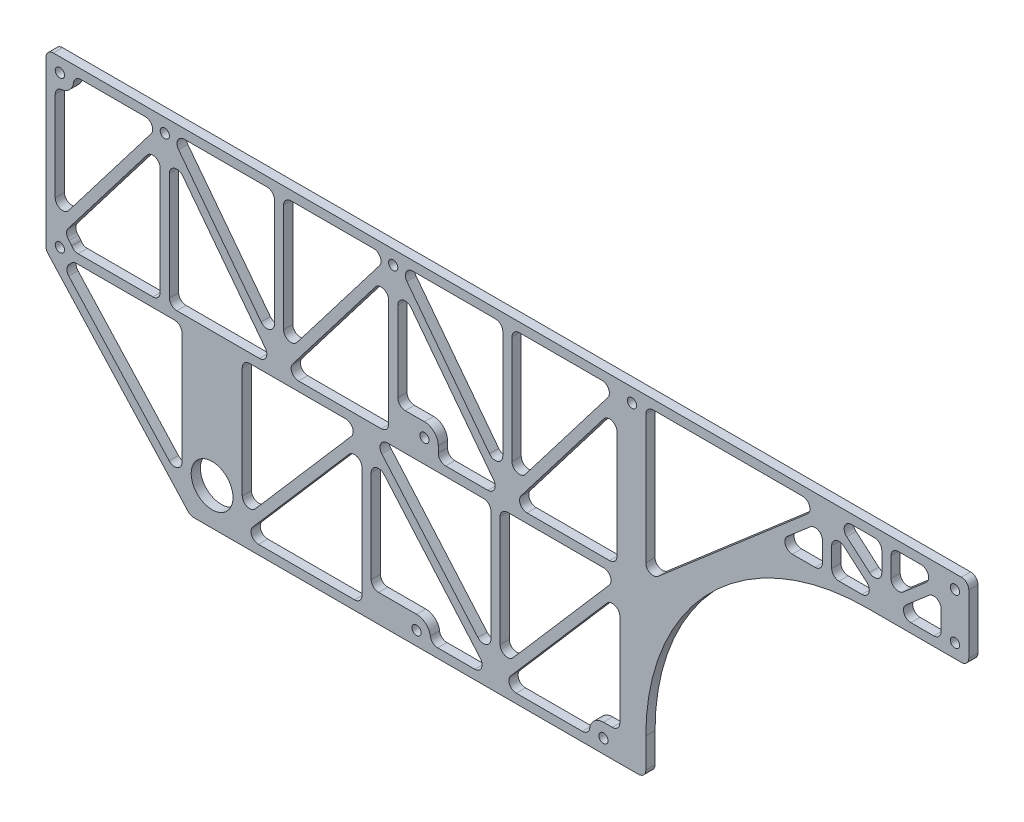
from build123d import *

# Parameters (mm, degrees)
SKETCH1_W           = 635
SKETCH1_H           = 228.6
SKETCH1_R           = 14.3891
BOSS_EXTRUDE1_DEPTH = 6.35
SKETCH2_R           = 3.175
CUT_EXTRUDE1_DEPTH  = 338.507129554
LPATTERN2_DEPTH     = 6.35
SKETCH3_R           = 3.175
BOSS_EXTRUDE2_DEPTH = 6.35
SKETCH4_R           = 3.175
BOSS_EXTRUDE5_DEPTH = 6.35
CUT_EXTRUDE2_DEPTH  = 338.507129566
SKETCH6_R           = 9.525
SKETCH6_R_2         = 3.175
BOSS_EXTRUDE6_DEPTH = 6.35
SKETCH6_4_R         = 3.175
CUT_EXTRUDE4_DEPTH  = 338.507129554
FILLET1_R           = 5.08
SKETCH7_W           = 222.25
SKETCH7_H           = 287.708406978
CUT_EXTRUDE5_DEPTH  = 338.507129554
SKETCH8_W           = 13.49375
SKETCH8_H           = 228.6
BOSS_EXTRUDE7_DEPTH = 6.35
SKETCH9_R           = 3.175
CUT_EXTRUDE6_DEPTH  = 338.507129554
FILLET2_R           = 5.08
SKETCH12_R          = 3.175
BOSS_EXTRUDE8_DEPTH = 6.35
SKETCH13_W          = 222.25
SKETCH13_H          = 50.8
BOSS_EXTRUDE9_DEPTH = 6.35
SKETCH14_R          = 3.175
CUT_EXTRUDE7_DEPTH  = 338.507129554
FILLET3_R           = 5.08


with BuildPart() as part:
    # Sketch1 → Boss-Extrude1 (new body)
    with BuildSketch(Plane.XY):
        Rectangle(SKETCH1_W, SKETCH1_H)
        with Locations((206.82458, -88.9)):
            Circle(SKETCH1_R, mode=Mode.SUBTRACT)
        with Locations((-203.2, -88.9)):
            Circle(SKETCH1_R, mode=Mode.SUBTRACT)
    extrude(amount=BOSS_EXTRUDE1_DEPTH)

    # Sketch2 → Cut-Extrude1 (cut, through all)
    with BuildSketch(Plane.XY.offset(6.35)):
        with Locations((307.975, -104.775)):
            Circle(SKETCH2_R)
        with Locations(Location((-307.975, -104.775, 0), (0, 0, 180))):
            Circle(SKETCH2_R)
        with BuildLine():
            Line((-311.15, -12.584475377), (-311.15, -95.25))
            Line((-311.15, -95.25), (-307.975, -95.25))
            ThreePointArc((-307.975, -95.25), (-301.239807909, -98.039807909), (-298.45, -104.775))
            Line((-298.45, -104.775), (-298.45, -107.95))
            Line((-298.45, -107.95), (-223.9391, -107.95))
            Line((-223.9391, -107.95), (-311.15, -12.584475377))
        make_face()
        Polygon((-311.15, -3.175), (-223.9391, -98.540524623), (-223.9391, -3.175), align=None)
        Polygon((-311.15, 107.95), (-311.15, 13.619737424), (-238.91875, 107.95), align=None)
        with BuildLine():
            Line((311.15, -11.346724197), (311.15, -95.25))
            Line((311.15, -95.25), (307.975, -95.25))
            ThreePointArc((307.975, -95.25), (301.239807909, -98.039807909), (298.45, -104.775))
            Line((298.45, -104.775), (298.45, -107.95))
            Line((298.45, -107.95), (227.56368, -107.95))
            Line((227.56368, -107.95), (311.15, -11.346724197))
        make_face()
        Polygon((311.15, -1.64199312), (227.56368, -1.64199312), (227.56368, -98.245268924), align=None)
        Polygon((-238.91875, 97.505262576), (-311.15, 3.175), (-238.91875, 3.175), align=None)
        Polygon((-160.3375, 3.175), (-232.56875, 3.175), (-232.56875, 97.505262576), align=None)
        Polygon((-160.3375, 13.619737424), (-232.56875, 107.95), (-160.3375, 107.95), align=None)
        Polygon((-100.086795, -3.175), (-182.4609, -98.25253875), (-182.4609, -3.175), align=None)
        Polygon((-182.4609, -107.95), (-100.086795, -107.95), (-100.086795, -12.87246125), align=None)
        Polygon((-11.36269, -107.95), (-93.736795, -107.95), (-93.736795, -12.87246125), align=None)
        Polygon((-93.736795, -3.175), (-11.36269, -98.25253875), (-11.36269, -3.175), align=None)
        Polygon((-5.01269, -3.175), (77.361415, -3.175), (-5.01269, -98.25253875), align=None)
        Polygon((-5.01269, -107.95), (77.361415, -12.87246125), (77.361415, -107.95), align=None)
        Polygon((83.711415, -3.175), (186.08548, -3.175), (186.08548, -99.241977854), align=None)
        Polygon((83.711415, -11.883022146), (83.711415, -107.95), (186.08548, -107.95), align=None)
    extrude(amount=-CUT_EXTRUDE1_DEPTH, mode=Mode.SUBTRACT)

    # LPattern2: read off the stored shape, not the designer's step
    # LPattern2 outline → LPattern2 (cut)
    with BuildSketch(Plane.XY):
        Polygon((238.91875, 3.175), (311.15, 3.175), (238.91875, 97.505262576), align=None)
        Polygon((238.91875, 107.95), (311.15, 13.619737424), (311.15, 107.95), align=None)
        Polygon((160.3375, 13.619737424), (232.56875, 107.95), (160.3375, 107.95), align=None)
        Polygon((153.9875, 13.619737424), (153.9875, 107.95), (81.75625, 107.95), align=None)
        Polygon((3.175, 13.619737424), (75.40625, 107.95), (3.175, 107.95), align=None)
        Polygon((-3.175, 13.619737424), (-3.175, 107.95), (-75.40625, 107.95), align=None)
        Polygon((-153.9875, 13.619737424), (-81.75625, 107.95), (-153.9875, 107.95), align=None)
        Polygon((232.56875, 97.505262576), (160.3375, 3.175), (232.56875, 3.175), align=None)
        Polygon((81.75625, 97.505262576), (81.75625, 3.175), (153.9875, 3.175), align=None)
        Polygon((75.40625, 97.505262576), (3.175, 3.175), (75.40625, 3.175), align=None)
        Polygon((-75.40625, 97.505262576), (-75.40625, 3.175), (-3.175, 3.175), align=None)
        Polygon((-81.75625, 97.505262576), (-153.9875, 3.175), (-81.75625, 3.175), align=None)
    extrude(amount=LPATTERN2_DEPTH, mode=Mode.SUBTRACT)

    # Sketch3 → Boss-Extrude2 (add)
    # profile 1 of 4: a face of its own
    with BuildSketch(Plane.XY.offset(6.35)):
        with BuildLine():
            ThreePointArc((-298.45, 104.775), (-301.239807909, 98.039807909), (-307.975, 95.25))
            Line((-307.975, 95.25), (-311.15, 95.25))
            Line((-311.15, 95.25), (-311.15, 107.95))
            Line((-311.15, 107.95), (-298.45, 107.95))
            Line((-298.45, 107.95), (-298.45, 104.775))
        make_face()
        with Locations((-307.975, 104.775)):
            Circle(SKETCH3_R, mode=Mode.SUBTRACT)
    # profile 2 of 4: a face of its own
    with BuildSketch(Plane.XY.offset(6.35)):
        with BuildLine():
            Line((298.45, 104.775), (298.45, 107.95))
            Line((298.45, 107.95), (311.15, 107.95))
            Line((311.15, 107.95), (311.15, 95.25))
            Line((311.15, 95.25), (307.975, 95.25))
            ThreePointArc((307.975, 95.25), (301.239807909, 98.039807909), (298.45, 104.775))
        make_face()
        with Locations((307.975, 104.775)):
            Circle(SKETCH3_R, mode=Mode.SUBTRACT)
    # profile 3 of 4: a face of its own
    with BuildSketch(Plane.XY.offset(6.35)):
        with BuildLine():
            Line((311.15, 107.95), (307.975, 107.95))
            ThreePointArc((307.975, 107.95), (310.22006403, 107.02006403), (311.15, 104.775))
            Line((311.15, 104.775), (311.15, 107.95))
        make_face()
    # profile 4 of 4: a face of its own
    with BuildSketch(Plane.XY.offset(6.35)):
        with BuildLine():
            Line((-311.15, 107.95), (-311.15, 104.775))
            ThreePointArc((-311.15, 104.775), (-310.22006403, 107.02006403), (-307.975, 107.95))
            Line((-307.975, 107.95), (-311.15, 107.95))
        make_face()
    extrude(amount=-BOSS_EXTRUDE2_DEPTH)

    # Sketch4 → Boss-Extrude5 (add)
    # profile 1 of 2: a face of its own
    with BuildSketch(Plane(origin=(0, 0, 0), x_dir=(-1, 0, 0), z_dir=(0, 0, -1))):
        with BuildLine():
            Line((-56.55818, -104.775), (-56.55818, -114.3))
            Line((-56.55818, -114.3), (-83.711415, -114.3))
            Line((-83.711415, -114.3), (-83.711415, -95.25))
            Line((-83.711415, -95.25), (-66.08318, -95.25))
            ThreePointArc((-66.08318, -95.25), (-59.347987909, -98.039807909), (-56.55818, -104.775))
        make_face()
        with Locations((-66.08318, -104.775)):
            Circle(SKETCH4_R, mode=Mode.SUBTRACT)
    # profile 2 of 2: a face of its own
    with BuildSketch(Plane(origin=(0, 0, 0), x_dir=(-1, 0, 0), z_dir=(0, 0, -1))):
        with BuildLine():
            ThreePointArc((52.9336, -104.775), (55.723407909, -98.039807909), (62.4586, -95.25))
            Line((62.4586, -95.25), (100.086795, -95.25))
            Line((100.086795, -95.25), (100.086795, -114.3))
            Line((100.086795, -114.3), (52.9336, -114.3))
            Line((52.9336, -114.3), (52.9336, -104.775))
        make_face()
        with Locations((62.4586, -104.775)):
            Circle(SKETCH4_R, mode=Mode.SUBTRACT)
    extrude(amount=-BOSS_EXTRUDE5_DEPTH)

    # Sketch5 → Cut-Extrude2 (cut, through all)
    with BuildSketch(Plane(origin=(0, 0, 0), x_dir=(-1, 0, 0), z_dir=(0, 0, -1))):
        Polygon((-328.541000194, 8.752588565), (-195.250866234, -145.294910748), (-328.541000194, -145.294910748), align=None)
        Polygon((209.527146653, -123.709537991), (340.288435142, 19.278538924), (340.288435142, -123.709537991), align=None)
    extrude(amount=-CUT_EXTRUDE2_DEPTH, mode=Mode.SUBTRACT)

    # Sketch6 → Boss-Extrude6 (add)
    # profile 1 of 2: a face of its own
    with BuildSketch(Plane(origin=(0, 0, 0), x_dir=(-1, 0, 0), z_dir=(0, 0, -1))):
        with Locations((-307.975, 0.76650344)):
            Circle(SKETCH6_R)
        with Locations((-307.975, 0.76650344)):
            Circle(SKETCH6_R_2, mode=Mode.SUBTRACT)
    # profile 2 of 2: a face of its own
    with BuildSketch(Plane(origin=(0, 0, 0), x_dir=(-1, 0, 0), z_dir=(0, 0, -1))):
        with Locations((307.975, 0.76650344)):
            Circle(SKETCH6_R)
        with Locations((307.975, 0.76650344)):
            Circle(SKETCH6_R_2, mode=Mode.SUBTRACT)
    extrude(amount=-BOSS_EXTRUDE6_DEPTH)

    # Sketch6<4> → Cut-Extrude4 (cut, through all)
    with BuildSketch(Plane(origin=(0, 0, 0), x_dir=(-1, 0, 0), z_dir=(0, 0, -1))):
        with Locations((307.975, 0.76650344)):
            Circle(SKETCH6_4_R)
        with Locations((-307.975, 0.76650344)):
            Circle(SKETCH6_4_R)
    extrude(amount=-CUT_EXTRUDE4_DEPTH, mode=Mode.SUBTRACT)

    # Fillet1
    # the kernel refuses this fillet: 5.08 mm, written as the material it adds along each edge
    with BuildSketch(Plane(origin=(83.711415, -11.883022146, 6.35), x_dir=(0.7292126608683634, -0.6842871438433438, 0), z_dir=(0, 0, -1))) as fillet1_piece_1:
        with BuildLine():
            CenterArc((FILLET1_R * 2.30973381872, FILLET1_R), FILLET1_R, 136.820429188, 133.179570812)
            Line((FILLET1_R * 1.58052115785, FILLET1_R * 1.68428714384), (0, 0))
            Line((0, 0), (FILLET1_R * 2.30973381872, 0))
        make_face()
    extrude(amount=6.35)
    with BuildSketch(Plane(origin=(186.08548, -107.95, 6.35), x_dir=(-0.7292126608683638, 0.6842871438433435, 0), z_dir=(0, 0, -1)), Plane(origin=(83.711415, -3.175, 6.35), x_dir=(0.7292126608683626, -0.6842871438433448, 0), z_dir=(0, 0, -1))) as fillet1_piece_2:
        with BuildLine():
            CenterArc((FILLET1_R * 2.52702783682, -FILLET1_R), FILLET1_R, 90, 136.820429188)
            Line((FILLET1_R * 1.84274069297, -FILLET1_R * 1.72921266087), (0, 0))
            Line((0, 0), (FILLET1_R * 2.52702783682, 0))
        make_face()
    extrude(amount=6.35)
    with BuildSketch(Plane(origin=(83.711415, -107.95, 6.35), x_dir=(1, 0, 0), z_dir=(0, 0, -1)), Plane(origin=(-182.4609, -3.175, 6.35), x_dir=(0, -1, 0), z_dir=(0, 0, -1)), Plane(origin=(-100.086795, -107.95, 6.35), x_dir=(0, 1, 0), z_dir=(0, 0, -1)), Plane(origin=(227.56368, -1.64199312, 6.35), x_dir=(0, -1, 0), z_dir=(0, 0, -1)), Plane(origin=(-81.75625, 3.175, 0), x_dir=(-1, 0, 0), z_dir=(0, 0, 1)), Plane(origin=(-153.9875, 107.95, 0), x_dir=(1, 0, 0), z_dir=(0, 0, 1)), Plane(origin=(75.40625, 3.175, 0), x_dir=(-1, 0, 0), z_dir=(0, 0, 1)), Plane(origin=(3.175, 107.95, 0), x_dir=(1, 0, 0), z_dir=(0, 0, 1)), Plane(origin=(232.56875, 3.175, 0), x_dir=(-1, 0, 0), z_dir=(0, 0, 1)), Plane(origin=(160.3375, 107.95, 0), x_dir=(1, 0, 0), z_dir=(0, 0, 1)), Plane(origin=(238.91875, 3.175, 0), x_dir=(0, 1, 0), z_dir=(0, 0, 1)), Plane(origin=(-93.736795, -95.25, 6.35), x_dir=(1, 0, 0), z_dir=(0, 0, -1)), Plane(origin=(-160.3375, 107.95, 6.35), x_dir=(-1, 0, 0), z_dir=(0, 0, -1)), Plane(origin=(-5.01269, -3.175, 6.35), x_dir=(0, -1, 0), z_dir=(0, 0, -1)), Plane(origin=(-238.91875, 3.175, 6.35), x_dir=(0, 1, 0), z_dir=(0, 0, -1))) as fillet1_piece_3:
        with BuildLine():
            CenterArc((FILLET1_R, -FILLET1_R), FILLET1_R, 90, 90)
            Line((0, -FILLET1_R), (0, 0))
            Line((0, 0), (FILLET1_R, 0))
        make_face()
    extrude(amount=6.35)
    with BuildSketch(Plane(origin=(186.08548, -99.241977854, 6.35), x_dir=(0, 1, 0), z_dir=(0, 0, -1))) as fillet1_piece_4:
        with BuildLine():
            CenterArc((FILLET1_R * 2.30973381872, -FILLET1_R), FILLET1_R, 90, 133.179570812)
            Line((FILLET1_R * 1.58052115785, -FILLET1_R * 1.68428714384), (0, 0))
            Line((0, 0), (FILLET1_R * 2.30973381872, 0))
        make_face()
    extrude(amount=6.35)
    with BuildSketch(Plane(origin=(186.08548, -3.175, 6.35), x_dir=(0, -1, 0), z_dir=(0, 0, -1)), Plane(origin=(-223.9391, -3.175, 6.35), x_dir=(0, -1, 0), z_dir=(0, 0, -1)), Plane(origin=(-11.36269, -3.175, 6.35), x_dir=(0, -1, 0), z_dir=(0, 0, -1)), Plane(origin=(-75.40625, 3.175, 0), x_dir=(1, 0, 0), z_dir=(0, 0, 1)), Plane(origin=(-3.175, 107.95, 0), x_dir=(-1, 0, 0), z_dir=(0, 0, 1)), Plane(origin=(81.75625, 3.175, 0), x_dir=(1, 0, 0), z_dir=(0, 0, 1)), Plane(origin=(153.9875, 107.95, 0), x_dir=(-1, 0, 0), z_dir=(0, 0, 1)), Plane(origin=(77.361415, -95.25, 0), x_dir=(0, 1, 0), z_dir=(0, 0, 1)), Plane(origin=(-232.56875, 3.175, 6.35), x_dir=(0, 1, 0), z_dir=(0, 0, -1))) as fillet1_piece_5:
        with BuildLine():
            CenterArc((FILLET1_R, FILLET1_R), FILLET1_R, 180, 90)
            Line((0, FILLET1_R), (0, 0))
            Line((0, 0), (FILLET1_R, 0))
        make_face()
    extrude(amount=6.35)
    with BuildSketch(Plane(origin=(-5.01269, -107.95, 6.35), x_dir=(0.6548105567161749, 0.7557930502545342, 0), z_dir=(0, 0, -1)), Plane(origin=(-182.4609, -107.95, 6.35), x_dir=(0.6548105567161759, 0.7557930502545335, 0), z_dir=(0, 0, -1)), Plane(origin=(77.361415, -3.175, 6.35), x_dir=(-0.6548105567161753, -0.755793050254534, 0), z_dir=(0, 0, -1))) as fillet1_piece_6:
        with BuildLine():
            CenterArc((FILLET1_R * 2.18950221381, FILLET1_R), FILLET1_R, 139.094713077, 130.905286923)
            Line((FILLET1_R * 1.43370916356, FILLET1_R * 1.65481055672), (0, 0))
            Line((0, 0), (FILLET1_R * 2.18950221381, 0))
        make_face()
    extrude(amount=6.35)
    with BuildSketch(Plane(origin=(77.361415, -12.87246125, 6.35), x_dir=(-0.6548105567161752, -0.7557930502545341, 0), z_dir=(0, 0, -1)), Plane(origin=(-100.086795, -12.87246125, 6.35), x_dir=(-0.6548105567161748, -0.7557930502545345, 0), z_dir=(0, 0, -1)), Plane(origin=(-11.36269, -98.25253875, 6.35), x_dir=(0, 1, 0), z_dir=(0, 0, -1)), Plane(origin=(-5.01269, -98.25253875, 6.35), x_dir=(0.654810556716175, 0.7557930502545342, 0), z_dir=(0, 0, -1))) as fillet1_piece_7:
        with BuildLine():
            CenterArc((FILLET1_R * 2.6813756013, -FILLET1_R), FILLET1_R, 90, 139.094713077)
            Line((FILLET1_R * 2.02656504459, -FILLET1_R * 1.75579305025), (0, 0))
            Line((0, 0), (FILLET1_R * 2.6813756013, 0))
        make_face()
    extrude(amount=6.35)
    with BuildSketch(Plane(origin=(-100.086795, -3.175, 6.35), x_dir=(-1, 0, 0), z_dir=(0, 0, -1)), Plane(origin=(-11.36269, -107.95, 6.35), x_dir=(-0.654810556716176, 0.7557930502545334, 0), z_dir=(0, 0, -1)), Plane(origin=(-93.736795, -3.175, 6.35), x_dir=(0.6548105567161754, -0.7557930502545338, 0), z_dir=(0, 0, -1))) as fillet1_piece_8:
        with BuildLine():
            CenterArc((FILLET1_R * 2.18950221381, -FILLET1_R), FILLET1_R, 90, 130.905286923)
            Line((FILLET1_R * 1.43370916356, -FILLET1_R * 1.65481055672), (0, 0))
            Line((0, 0), (FILLET1_R * 2.18950221381, 0))
        make_face()
    extrude(amount=6.35)
    with BuildSketch(Plane(origin=(-182.4609, -98.25253875, 6.35), x_dir=(0, 1, 0), z_dir=(0, 0, -1)), Plane(origin=(-93.736795, -12.87246125, 6.35), x_dir=(0.654810556716175, -0.7557930502545342, 0), z_dir=(0, 0, -1))) as fillet1_piece_9:
        with BuildLine():
            CenterArc((FILLET1_R * 2.6813756013, FILLET1_R), FILLET1_R, 130.905286923, 139.094713077)
            Line((FILLET1_R * 2.02656504459, FILLET1_R * 1.75579305025), (0, 0))
            Line((0, 0), (FILLET1_R * 2.6813756013, 0))
        make_face()
    extrude(amount=6.35)
    with BuildSketch(Plane(origin=(-223.9391, -98.540524623, 6.35), x_dir=(0, 1, 0), z_dir=(0, 0, -1))) as fillet1_piece_10:
        with BuildLine():
            CenterArc((FILLET1_R * 2.57531179539, -FILLET1_R), FILLET1_R, 90, 137.557368834)
            Line((FILLET1_R * 1.90046014371, -FILLET1_R * 1.73795341873), (0, 0))
            Line((0, 0), (FILLET1_R * 2.57531179539, 0))
        make_face()
    extrude(amount=6.35)
    with BuildSketch(Plane(origin=(-238.91875, 107.95, 6.35), x_dir=(-0.6079616693417654, -0.7939663775067392, 0), z_dir=(0, 0, -1)), Plane(origin=(-153.9875, 3.175, 0), x_dir=(1, 0, 0), z_dir=(0, 0, 1)), Plane(origin=(-81.75625, 107.95, 0), x_dir=(-1, 0, 0), z_dir=(0, 0, 1)), Plane(origin=(3.175, 3.175, 0), x_dir=(1, 0, 0), z_dir=(0, 0, 1)), Plane(origin=(75.40625, 107.95, 0), x_dir=(-1, 0, 0), z_dir=(0, 0, 1)), Plane(origin=(160.3375, 3.175, 0), x_dir=(1, 0, 0), z_dir=(0, 0, 1)), Plane(origin=(232.56875, 107.95, 0), x_dir=(-1, 0, 0), z_dir=(0, 0, 1)), Plane(origin=(238.91875, 107.95, 0), x_dir=(0.6079616693426445, -0.793966377506066, 0), z_dir=(0, 0, 1)), Plane(origin=(-232.56875, 107.95, 6.35), x_dir=(1, 0, 0), z_dir=(0, 0, -1))) as fillet1_piece_11:
        with BuildLine():
            CenterArc((FILLET1_R * 2.02522640114, FILLET1_R), FILLET1_R, 142.557736131, 127.442263869)
            Line((FILLET1_R * 1.23126002363, FILLET1_R * 1.60796166934), (0, 0))
            Line((0, 0), (FILLET1_R * 2.02522640114, 0))
        make_face()
    extrude(amount=6.35)
    with BuildSketch(Plane(origin=(-311.15, 13.619737424, 6.35), x_dir=(0.6079616693417668, 0.7939663775067382, 0), z_dir=(0, 0, -1)), Plane(origin=(-232.56875, 97.505262576, 6.35), x_dir=(0, -1, 0), z_dir=(0, 0, -1)), Plane(origin=(-160.3375, 13.619737424, 6.35), x_dir=(0, 1, 0), z_dir=(0, 0, -1))) as fillet1_piece_12:
        with BuildLine():
            CenterArc((FILLET1_R * 2.95078862365, -FILLET1_R), FILLET1_R, 90, 142.557736131)
            Line((FILLET1_R * 2.3428269543, -FILLET1_R * 1.79396637751), (0, 0))
            Line((0, 0), (FILLET1_R * 2.95078862365, 0))
        make_face()
    extrude(amount=6.35)
    with BuildSketch(Plane(origin=(227.56368, -98.245268924, 6.35), x_dir=(0, 1, 0), z_dir=(0, 0, -1))) as fillet1_piece_13:
        with BuildLine():
            CenterArc((FILLET1_R * 2.68403480269, FILLET1_R), FILLET1_R, 130.868111671, 139.131888329)
            Line((FILLET1_R * 2.02971476539, FILLET1_R * 1.75621775223), (0, 0))
            Line((0, 0), (FILLET1_R * 2.68403480269, 0))
        make_face()
    extrude(amount=6.35)
    with BuildSketch(Plane(origin=(-153.9875, 13.619737424, 0), x_dir=(0.6079616693426454, 0.7939663775060652, 0), z_dir=(0, 0, 1)), Plane(origin=(-81.75625, 97.505262576, 0), x_dir=(-0.6079616693426451, -0.7939663775060656, 0), z_dir=(0, 0, 1)), Plane(origin=(-75.40625, 97.505262576, 0), x_dir=(0, -1, 0), z_dir=(0, 0, 1)), Plane(origin=(-3.175, 13.619737424, 0), x_dir=(0, 1, 0), z_dir=(0, 0, 1)), Plane(origin=(3.175, 13.619737424, 0), x_dir=(0.6079616693426451, 0.7939663775060656, 0), z_dir=(0, 0, 1)), Plane(origin=(75.40625, 97.505262576, 0), x_dir=(-0.6079616693426451, -0.7939663775060656, 0), z_dir=(0, 0, 1)), Plane(origin=(81.75625, 97.505262576, 0), x_dir=(0, -1, 0), z_dir=(0, 0, 1)), Plane(origin=(153.9875, 13.619737424, 0), x_dir=(0, 1, 0), z_dir=(0, 0, 1)), Plane(origin=(160.3375, 13.619737424, 0), x_dir=(0.6079616693426452, 0.7939663775060656, 0), z_dir=(0, 0, 1)), Plane(origin=(232.56875, 97.505262576, 0), x_dir=(-0.6079616693426445, -0.7939663775060661, 0), z_dir=(0, 0, 1)), Plane(origin=(238.91875, 97.505262576, 0), x_dir=(0, -1, 0), z_dir=(0, 0, 1)), Plane(origin=(311.15, 13.619737424, 0), x_dir=(0, 1, 0), z_dir=(0, 0, 1)), Plane(origin=(-238.91875, 97.505262576, 6.35), x_dir=(0, -1, 0), z_dir=(0, 0, -1))) as fillet1_piece_14:
        with BuildLine():
            CenterArc((FILLET1_R * 2.95078862364, FILLET1_R), FILLET1_R, 127.442263869, 142.557736131)
            Line((FILLET1_R * 2.3428269543, FILLET1_R * 1.79396637751), (0, 0))
            Line((0, 0), (FILLET1_R * 2.95078862364, 0))
        make_face()
    extrude(amount=6.35)
    with BuildSketch(Plane(origin=(-3.175, 3.175, 0), x_dir=(-1, 0, 0), z_dir=(0, 0, 1)), Plane(origin=(-75.40625, 107.95, 0), x_dir=(1, 0, 0), z_dir=(0, 0, 1)), Plane(origin=(153.9875, 3.175, 0), x_dir=(-1, 0, 0), z_dir=(0, 0, 1)), Plane(origin=(81.75625, 107.95, 0), x_dir=(1, 0, 0), z_dir=(0, 0, 1)), Plane(origin=(-160.3375, 3.175, 6.35), x_dir=(-0.6079616693417668, 0.7939663775067382, 0), z_dir=(0, 0, -1))) as fillet1_piece_15:
        with BuildLine():
            CenterArc((FILLET1_R * 2.02522640114, -FILLET1_R), FILLET1_R, 90, 127.442263869)
            Line((FILLET1_R * 1.23126002363, -FILLET1_R * 1.60796166934), (0, 0))
            Line((0, 0), (FILLET1_R * 2.02522640114, 0))
        make_face()
    extrude(amount=6.35)
    with BuildSketch(Plane(origin=(-311.15, 95.25, 6.35), x_dir=(0, -1, 0), z_dir=(0, 0, -1))) as fillet1_piece_16:
        with BuildLine():
            CenterArc((4.955227899, -5.08), FILLET1_R, 90, 82.505282546)
            Line((-0.08137311, -4.417391304), (-0.58503321, -4.351130435))
            ThreePointArc((-0.58503321, -4.351130435), (-0.508, -3.175), (-0.508, 0))
            Line((-0.508, 0), (0, 0.508))
            Line((0, 0.508), (4.955227899, 0.508))
            Line((4.955227899, 0.508), (4.955227899, 0))
        make_face()
    extrude(amount=6.35)
    with BuildSketch(Plane(origin=(-298.45, 107.95, 6.35), x_dir=(-0.018417953265842307, -0.9998303751124473, 0), z_dir=(0, 0, -1)), Plane(origin=(311.15, 95.25, 6.35), x_dir=(-0.9998303751124473, 0.01841795326584564, 0), z_dir=(0, 0, -1)), Plane(origin=(56.55818, -107.95, 6.35), x_dir=(0.018417953265846054, 0.9998303751124473, 0), z_dir=(0, 0, -1))) as fillet1_piece_17:
        with BuildLine():
            CenterArc((4.98787315, -5.047950571), FILLET1_R, 96.439386794, 82.505282546)
            Line((-0.091265156, -4.954387369), (-0.599178986, -4.945031049))
            Line((-0.599178986, -4.945031049), (-0.507913831, 0.00935632))
            Line((-0.507913831, 0.00935632), (0.00935632, 0.507913831))
            ThreePointArc((0.00935632, 0.507913831), (3.183817761, 0.449436829), (4.361167489, 0.504795057))
            Line((4.361167489, 0.504795057), (4.418140731, 0))
        make_face()
    extrude(amount=6.35)
    with BuildSketch(Plane(origin=(298.45, 107.95, 6.35), x_dir=(0.018417953265842484, -0.9998303751124473, 0), z_dir=(0, 0, -1))) as fillet1_piece_18:
        with BuildLine():
            CenterArc((4.98787315, 5.047950571), FILLET1_R, 181.05533066, 82.505282546)
            Line((-0.091265156, 4.954387369), (-0.599178986, 4.945031049))
            Line((-0.599178986, 4.945031049), (-0.507913831, -0.00935632))
            Line((-0.507913831, -0.00935632), (0.00935632, -0.507913831))
            ThreePointArc((0.00935632, -0.507913831), (3.183817761, -0.449436829), (4.361167489, -0.504795057))
            Line((4.361167489, -0.504795057), (4.418140731, 0))
        make_face()
    extrude(amount=6.35)
    with BuildSketch(Plane(origin=(-52.9336, -107.95, 0), x_dir=(1, 0, 0), z_dir=(0, 0, 1))) as fillet1_piece_19:
        with BuildLine():
            CenterArc((4.955227899, 5.08), FILLET1_R, 187.494717454, 82.505282546)
            Line((-0.08137311, 4.417391304), (-0.58503321, 4.351130435))
            ThreePointArc((-0.58503321, 4.351130435), (-0.508, 3.175), (-0.508, 0))
            Line((-0.508, 0), (0, -0.508))
            Line((0, -0.508), (4.955227899, -0.508))
            Line((4.955227899, -0.508), (4.955227899, 0))
        make_face()
    extrude(amount=6.35)
    with BuildSketch(Plane(origin=(298.759536402, -1.64199312, 6.35), x_dir=(-1, 0, 0), z_dir=(0, 0, -1)), Plane(origin=(-298.759536402, 3.175, 6.35), x_dir=(1, 0, 0), z_dir=(0, 0, -1))) as fillet1_piece_20:
        with BuildLine():
            CenterArc((3.323613094, -5.08), FILLET1_R, 90, 59.153812332)
            ThreePointArc((-1.037804886, -2.475305544), (-0.431275513, -1.274391532), (0, 0))
            Line((0, 0), (3.323613094, 0))
        make_face()
    extrude(amount=6.35)
    with BuildSketch(Plane(origin=(305.879408363, 10.058119052, 6.35), x_dir=(-0.6079616693426482, 0.7939663775060631, 0), z_dir=(0, 0, -1))) as fillet1_piece_21:
        with BuildLine():
            CenterArc((5.912632715, -5.08), FILLET1_R, 90, 85.700712635)
            ThreePointArc((0.8469275, -4.699171074), (0.722701675, -2.295654147), (0, 0))
            Line((0, 0), (5.912632715, 0))
        make_face()
    extrude(amount=6.35)
    with BuildSketch(Plane(origin=(298.759536402, 3.175, 6.35), x_dir=(0.38665491780885, 0.9222244707956037, 0), z_dir=(0, 0, -1))) as fillet1_piece_22:
        with BuildLine():
            CenterArc((3.399808964, -5.029324309), FILLET1_R, 98.099669592, 59.153812332)
            Line((-1.285091348, -3.065117326), (0, 0))
            ThreePointArc((0, 0), (1.342029854, -0.095016921), (2.684059709, 0))
        make_face()
    extrude(amount=6.35)
    with BuildSketch(Plane(origin=(305.319249705, -8.380770218, 6.35), x_dir=(-0.8598995904858001, 0.5104632154057266, 0), z_dir=(0, 0, -1))) as fillet1_piece_23:
        with BuildLine():
            CenterArc((6.043692602, -4.918079844), FILLET1_R, 104.504961887, 85.668460571)
            Line((1.043562163, -5.815351033), (0, 0))
            ThreePointArc((0, 0), (2.385668132, -0.303600293), (4.771336265, 0))
        make_face()
    extrude(amount=6.35)
    with BuildSketch(Plane(origin=(-305.879408363, 10.058119052, 6.35), x_dir=(0.8892122536298619, -0.4574948830254848, 0), z_dir=(0, 0, -1))) as fillet1_piece_24:
        with BuildLine():
            CenterArc((6.04818345, -4.917835152), FILLET1_R, 104.515976585, 85.700712635)
            Line((1.048732008, -5.81888192), (0, 0))
            ThreePointArc((0, 0), (2.387440836, -0.30405909), (4.774881671, 0))
        make_face()
    extrude(amount=6.35)
    with BuildSketch(Plane(origin=(-299.303773118, -3.175, 6.35), x_dir=(-0.5194631903932906, -0.8544928284230499, 0), z_dir=(0, 0, -1))) as fillet1_piece_25:
        with BuildLine():
            CenterArc((2.878871787, -5.043715806), FILLET1_R, 96.852094637, 51.851655106)
            Line((-1.461951781, -2.404842799), (0, 0))
            ThreePointArc((0, 0), (1.136396758, -0.068032864), (2.272793516, 0))
        make_face()
    extrude(amount=6.35)
    with BuildSketch(Plane(origin=(-306.197038926, -8.591085962, 6.35), x_dir=(0.6748516516870914, -0.737953418729939, 0), z_dir=(0, 0, -1))) as fillet1_piece_26:
        with BuildLine():
            CenterArc((6.499471605, -5.08), FILLET1_R, 90, 89.697659737)
            ThreePointArc((1.419542331, -5.053193812), (1.064713838, -2.426886472), (0, 0))
            Line((0, 0), (6.499471605, 0))
        make_face()
    extrude(amount=6.35)
    # the kernel refuses this fillet: 5.08 mm, written as the material it takes off along each edge
    with BuildSketch(Plane(origin=(317.5, -4.007834276, 11.081682312), x_dir=(0, 1, 0), z_dir=(0, 0, -1))) as fillet1_2_piece_1:
        with BuildLine():
            CenterArc((FILLET1_R * 0.372573410373, -FILLET1_R), FILLET1_R, 90, 40.868111671)
            Line((-FILLET1_R * 0.281746626932, -FILLET1_R * 0.243782247774), (0, 0))
            Line((0, 0), (FILLET1_R * 0.372573410373, 0))
        make_face()
    extrude(amount=15.813364623, mode=Mode.SUBTRACT)
    with BuildSketch(Plane(origin=(222.069320439, -114.3, -5.805385437), x_dir=(0.6543200373047124, 0.7562177522258783, 0), z_dir=(0, 0, 1))) as fillet1_2_piece_2:
        with BuildLine():
            CenterArc((FILLET1_R * 0.45711696357, FILLET1_R), FILLET1_R, 220.868111671, 49.131888329)
            Line((-FILLET1_R * 0.299100788656, FILLET1_R * 0.345679962695), (0, 0))
            Line((0, 0), (FILLET1_R * 0.45711696357, 0))
        make_face()
    extrude(amount=17.960770875, mode=Mode.SUBTRACT)
    with BuildSketch(Plane(origin=(-317.5, -5.640720854, -4.931441708), x_dir=(0, 1, 0), z_dir=(0, 0, 1))) as fillet1_2_piece_3:
        with BuildLine():
            CenterArc((FILLET1_R * 0.388302496726, -FILLET1_R), FILLET1_R, 90, 42.442631166)
            Line((-FILLET1_R * 0.286549154961, -FILLET1_R * 0.26204658127), (0, 0))
            Line((0, 0), (FILLET1_R * 0.388302496726, 0))
        make_face()
    extrude(amount=16.212883417, mode=Mode.SUBTRACT)
    with BuildSketch(Plane(origin=(-218.132083081, -114.3, 11.945724498), x_dir=(-0.6748516516870972, 0.7379534187299338, 0), z_dir=(0, 0, -1))) as fillet1_2_piece_4:
        with BuildLine():
            CenterArc((FILLET1_R * 0.440608228189, FILLET1_R), FILLET1_R, 222.442631166, 47.557368834)
            Line((-FILLET1_R * 0.297345190541, FILLET1_R * 0.325148348313), (0, 0))
            Line((0, 0), (FILLET1_R * 0.440608228189, 0))
        make_face()
    extrude(amount=17.541448996, mode=Mode.SUBTRACT)
    with BuildSketch(Plane(origin=(-317.5, 114.3, -12.7), x_dir=(1, 0, 0), z_dir=(0, 0, 1))) as fillet1_2_piece_5:
        with BuildLine():
            CenterArc((FILLET1_R, -FILLET1_R), FILLET1_R, 90, 90)
            Line((0, -FILLET1_R), (0, 0))
            Line((0, 0), (FILLET1_R, 0))
        make_face()
    extrude(amount=31.75, mode=Mode.SUBTRACT)
    with BuildSketch(Plane(origin=(317.5, 114.3, -12.7), x_dir=(-1, 0, 0), z_dir=(0, 0, 1))) as fillet1_2_piece_6:
        with BuildLine():
            CenterArc((FILLET1_R, FILLET1_R), FILLET1_R, 180, 90)
            Line((0, FILLET1_R), (0, 0))
            Line((0, 0), (FILLET1_R, 0))
        make_face()
    extrude(amount=31.75, mode=Mode.SUBTRACT)

    # Sketch7 → Cut-Extrude5 (cut, through all)
    with BuildSketch(Plane(origin=(0, 0, 0), x_dir=(-1, 0, 0), z_dir=(0, 0, -1))):
        with Locations((-206.375, -17.793395336)):
            Rectangle(SKETCH7_W, SKETCH7_H)
    extrude(amount=-CUT_EXTRUDE5_DEPTH, mode=Mode.SUBTRACT)

    # Sketch8 → Boss-Extrude7 (add)
    with BuildSketch(Plane(origin=(0, 0, 0), x_dir=(-1, 0, 0), z_dir=(0, 0, -1))):
        with Locations((-88.503125, 0)):
            Rectangle(SKETCH8_W, SKETCH8_H)
    extrude(amount=-BOSS_EXTRUDE7_DEPTH)

    # Sketch9 → Cut-Extrude6 (cut, through all)
    with BuildSketch(Plane(origin=(0, 0, 0), x_dir=(-1, 0, 0), z_dir=(0, 0, -1))):
        with Locations((-85.725, 104.775)):
            Circle(SKETCH9_R)
    extrude(amount=-CUT_EXTRUDE6_DEPTH, mode=Mode.SUBTRACT)

    # Fillet2
    fillet2_edges = [part.edges().sort_by_distance(p)[0] for p in [
        (95.25, -114.3, 3.175),
    ]]
    fillet(fillet2_edges, radius=FILLET2_R)

    # Sketch12 → Boss-Extrude8 (add)
    with BuildSketch(Plane(origin=(0, 0, 0), x_dir=(-1, 0, 0), z_dir=(0, 0, -1))):
        with BuildLine():
            Line((47.56912, -3.175), (81.75625, -3.175))
            Line((81.75625, -3.175), (81.75625, 22.225))
            Line((81.75625, 22.225), (75.40625, 22.225))
            Line((75.40625, 22.225), (75.40625, 27.305))
            ThreePointArc((75.40625, 27.305), (73.918352448, 23.712897552), (70.32625, 22.225))
            Line((70.32625, 22.225), (57.09412, 22.225))
            ThreePointArc((57.09412, 22.225), (50.358927909, 19.435192091), (47.56912, 12.7))
            Line((47.56912, 12.7), (47.56912, 8.255))
            ThreePointArc((47.56912, 8.255), (46.081222448, 4.662897552), (42.48912, 3.175))
            Line((42.48912, 3.175), (47.56912, 3.175))
            Line((47.56912, 3.175), (47.56912, -3.175))
        make_face()
        with Locations((57.09412, 12.7)):
            Circle(SKETCH12_R, mode=Mode.SUBTRACT)
    extrude(amount=-BOSS_EXTRUDE8_DEPTH)

    # Sketch13 → Boss-Extrude9 (add)
    with BuildSketch(Plane(origin=(0, 0, 0), x_dir=(-1, 0, 0), z_dir=(0, 0, -1))):
        with BuildLine():
            Line((-95.25, -88.9), (-95.25, 63.5))
            Line((-95.25, 63.5), (-247.65, 63.5))
            ThreePointArc((-247.65, 63.5), (-139.886926547, 18.863073453), (-95.25, -88.9))
        make_face()
        with Locations((-206.375, 88.9)):
            Rectangle(SKETCH13_W, SKETCH13_H)
    extrude(amount=-BOSS_EXTRUDE9_DEPTH)

    # Sketch14 → Cut-Extrude7 (cut, through all)
    with BuildSketch(Plane(origin=(0, 0, 0), x_dir=(-1, 0, 0), z_dir=(0, 0, -1))):
        Polygon((-182.326381861, 69.85), (-216.800921241, 99.566515734), (-216.800921241, 69.85), align=None)
        Polygon((-263.97546062, 69.85), (-298.45, 99.566515734), (-298.45, 69.85), align=None)
        Polygon((-263.97546062, 107.95), (-298.45, 107.95), (-263.97546062, 78.233484266), align=None)
        Polygon((-257.62546062, 69.85), (-223.150921241, 69.85), (-223.150921241, 99.566515734), align=None)
        Polygon((-223.150921241, 107.95), (-257.62546062, 107.95), (-257.62546062, 78.233484266), align=None)
        Polygon((-95.25, 107.95), (-216.800921241, 107.95), (-95.25, 3.175), align=None)
        with Locations((-307.975, 104.775)):
            Circle(SKETCH14_R)
        with Locations((-307.975, 73.025)):
            Circle(SKETCH14_R)
        with Locations((78.58125, 104.775)):
            Circle(SKETCH14_R)
        with Locations((235.74375, 104.775)):
            Circle(SKETCH14_R)
    extrude(amount=-CUT_EXTRUDE7_DEPTH, mode=Mode.SUBTRACT)

    # Fillet3
    fillet3_edges = [part.edges().sort_by_distance(p)[0] for p in [
        (317.5, 63.5, 3.175),
        (317.5, 114.3, 3.175),
        (216.800921241, 69.85, 3.175),
        (216.800921241, 99.566515734, 3.175),
        (182.326381861, 69.85, 3.175),
        (257.62546062, 69.85, 3.175),
        (223.150921241, 99.566515734, 3.175),
        (223.150921241, 69.85, 3.175),
        (263.97546062, 78.233484266, 3.175),
        (298.45, 107.95, 3.175),
        (263.97546062, 107.95, 3.175),
        (257.62546062, 78.233484266, 3.175),
        (257.62546062, 107.95, 3.175),
        (223.150921241, 107.95, 3.175),
        (216.800921241, 107.95, 3.175),
        (95.25, 107.95, 3.175),
        (95.25, 3.175, 3.175),
        (263.97546062, 69.85, 3.175),
        (298.45, 69.85, 3.175),
        (298.45, 99.566515734, 3.175),
    ]]
    fillet(fillet3_edges, radius=FILLET3_R)


solid = part.part
